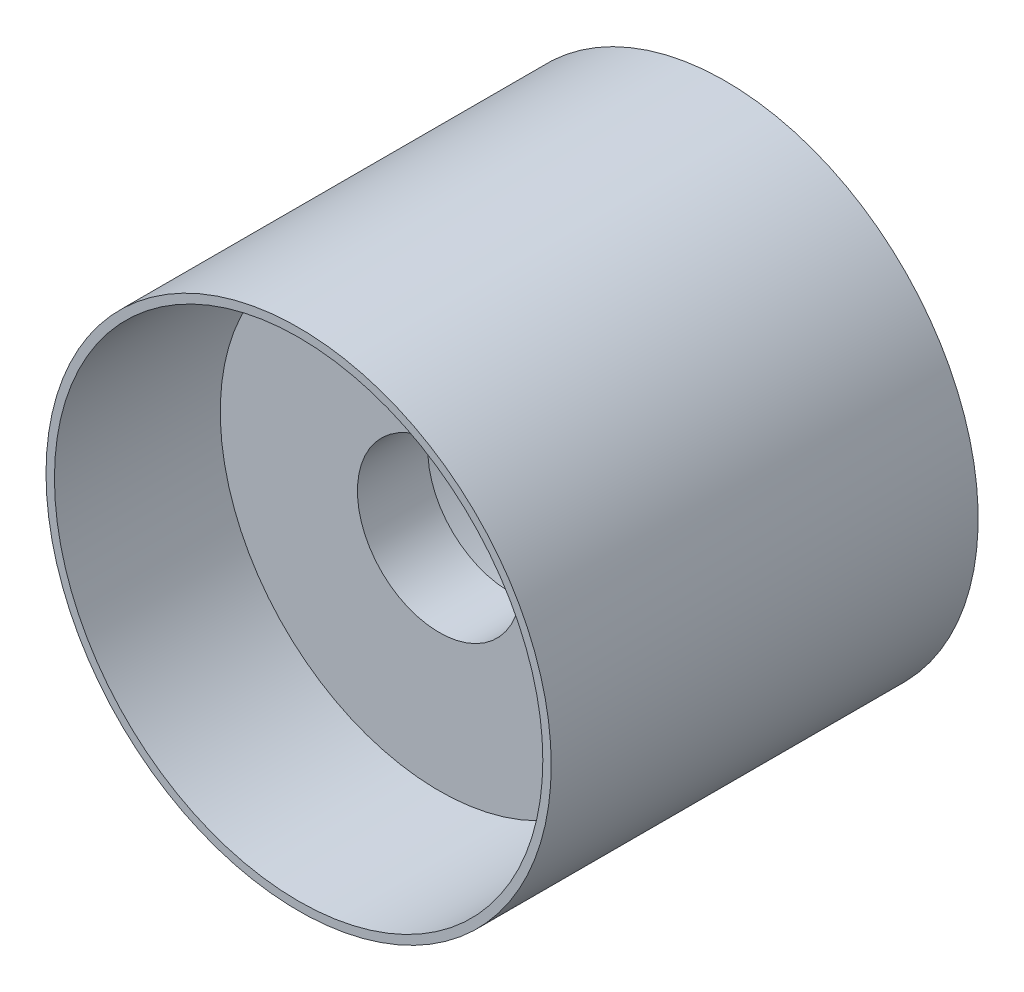
from build123d import *

# Parameters (mm, degrees)
BOSS_EXTRUDE2_DEPTH      = 259
BOSS_EXTRUDE2_DEPTH_BACK = 238
SKETCH5_R                = 300
SKETCH5_R_2              = 290
CUT_EXTRUDE1_DEPTH       = 186
CUT_EXTRUDE1_DEPTH_BACK  = 76
SKETCH6_R                = 97.102355
SKETCH7_R                = 300
BOSS_EXTRUDE5_DEPTH      = 10
SKETCH8_W                = 63.782423146
SKETCH8_H                = 50
SKETCH8_W_2              = 63.78242
BOSS_EXTRUDE6_DEPTH      = 10
SKETCH9_W                = 7.546412457
SKETCH9_H                = 50
BOSS_EXTRUDE7_DEPTH      = 80
SKETCH10_W               = 7.262070367
SKETCH10_H               = 50
BOSS_EXTRUDE8_DEPTH      = 158.04274
SKETCH13_W               = 7.54641
SKETCH13_H               = 50
BOSS_EXTRUDE9_DEPTH      = 80
FILLET3_R                = 5


with BuildPart() as part:
    # Sketch3 → Revolve2 (revolve)
    with BuildSketch(Plane(origin=(0, 0, 0), x_dir=(1, 0, 0), z_dir=(0, 1, 0))):
        Polygon((0, 41.453192435), (260, -92.06405694), (0, -92.06405694), align=None)
    revolve(axis=Axis((0, 0, 92.06405694), (0, 0, -1)))

    # Sketch6 → Cut-Extrude1 (cut, two sides: drawn at the far end of the back side and taken through both)
    with BuildSketch(Plane.XY.offset(-CUT_EXTRUDE1_DEPTH_BACK)):
        Circle(SKETCH6_R)
    extrude(amount=CUT_EXTRUDE1_DEPTH + CUT_EXTRUDE1_DEPTH_BACK, mode=Mode.SUBTRACT)


with BuildPart() as body_2:
    # Sketch5 → Boss-Extrude2 (new, two sides: drawn at the far end of the back side and taken through both)
    with BuildSketch(Plane.XY.offset(-BOSS_EXTRUDE2_DEPTH_BACK)):
        Circle(SKETCH5_R)
        Circle(SKETCH5_R_2, mode=Mode.SUBTRACT)
    extrude(amount=BOSS_EXTRUDE2_DEPTH + BOSS_EXTRUDE2_DEPTH_BACK)

    # Sketch7 → Boss-Extrude5 (add)
    with BuildSketch(Plane(origin=(0, 0, -238), x_dir=(-1, 0, 0), z_dir=(0, 0, -1))):
        Circle(SKETCH7_R)
    extrude(amount=BOSS_EXTRUDE5_DEPTH)

    # Sketch8 → Boss-Extrude6 (add)
    with BuildSketch(Plane(origin=(0, 0, -248), x_dir=(-1, 0, 0), z_dir=(0, 0, -1))):
        with Locations((-110.912578662, 0)):
            Rectangle(SKETCH8_W, SKETCH8_H)
        with Locations((110.91258, 0)):
            Rectangle(SKETCH8_W_2, SKETCH8_H)
    extrude(amount=BOSS_EXTRUDE6_DEPTH)

    # Sketch9 → Boss-Extrude7 (add)
    with BuildSketch(Plane(origin=(0, 0, -258), x_dir=(-1, 0, 0), z_dir=(0, 0, -1))):
        with Locations((-82.794573318, 0)):
            Rectangle(SKETCH9_W, SKETCH9_H)
    extrude(amount=BOSS_EXTRUDE7_DEPTH)

    # Sketch10 → Boss-Extrude8 (add)
    with BuildSketch(Plane.ZY.offset(-79.021367089)):
        with Locations((-334.368964817, 0)):
            Rectangle(SKETCH10_W, SKETCH10_H)
    extrude(amount=BOSS_EXTRUDE8_DEPTH)

    # Sketch13 → Boss-Extrude9 (add)
    with BuildSketch(Plane(origin=(0, 0, -258), x_dir=(-1, 0, 0), z_dir=(0, 0, -1))):
        with Locations((82.794575, 0)):
            Rectangle(SKETCH13_W, SKETCH13_H)
    extrude(amount=BOSS_EXTRUDE9_DEPTH)

    # Fillet3
    # the kernel refuses this fillet: 5 mm, written as the material it adds along each edge
    with BuildSketch(Plane(origin=(86.567779546, 25, -258), x_dir=(1, 0, 0), z_dir=(0, -1, 0))) as fillet3_piece_1:
        with BuildLine():
            CenterArc((FILLET3_R, -FILLET3_R), FILLET3_R, 90, 90)
            Line((0, -FILLET3_R), (0, 0))
            Line((0, 0), (FILLET3_R, 0))
        make_face()
    fillet3_piece_1_solid = extrude(amount=50, mode=Mode.PRIVATE)
    with BuildSketch(Plane(origin=(-79.02137, -25, -330.737929633), x_dir=(0, 0, 1), z_dir=(0, 1, 0)), Plane(origin=(-86.56778, 25, -258), x_dir=(-1, 0, 0), z_dir=(0, -1, 0))) as fillet3_piece_2:
        with BuildLine():
            CenterArc((FILLET3_R, FILLET3_R), FILLET3_R, 180, 90)
            Line((0, FILLET3_R), (0, 0))
            Line((0, 0), (FILLET3_R, 0))
        make_face()
    fillet3_piece_2_solid = extrude(amount=50, mode=Mode.PRIVATE)
    add([fillet3_piece_1_solid, fillet3_piece_2_solid])
    # the kernel refuses this fillet: 5 mm, written as the material it takes off along each edge
    with BuildSketch(Plane(origin=(142.803790235, 37.5, -258), x_dir=(0, 0, 1), z_dir=(0, -1, 0)), Plane(origin=(-142.80379, -37.5, -258), x_dir=(0, 0, 1), z_dir=(0, 1, 0)), Plane(origin=(86.567779546, 37.5, -338), x_dir=(0, 0, 1), z_dir=(0, -1, 0))) as fillet3_2_piece_1:
        with BuildLine():
            CenterArc((FILLET3_R, FILLET3_R), FILLET3_R, 180, 90)
            Line((0, FILLET3_R), (0, 0))
            Line((0, 0), (FILLET3_R, 0))
        make_face()
    fillet3_2_piece_1_solid = extrude(amount=75, mode=Mode.PRIVATE)
    with BuildSketch(Plane(origin=(79.021367089, 25, -338), x_dir=(0, 0, 1), z_dir=(-1, 0, 0))) as fillet3_2_piece_2:
        with BuildLine():
            CenterArc((FILLET3_R, -FILLET3_R), FILLET3_R, 90, 90)
            Line((0, -FILLET3_R), (0, 0))
            Line((0, 0), (FILLET3_R, 0))
        make_face()
    fillet3_2_piece_2_solid = extrude(amount=158.042737089, mode=Mode.PRIVATE)
    with BuildSketch(Plane(origin=(-79.02137, 25, -338), x_dir=(0, 0, 1), z_dir=(-1, 0, 0))) as fillet3_2_piece_3:
        with BuildLine():
            CenterArc((FILLET3_R, -FILLET3_R), FILLET3_R, 90, 90)
            Line((0, -FILLET3_R), (0, 0))
            Line((0, 0), (FILLET3_R, 0))
        make_face()
    fillet3_2_piece_3_solid = extrude(amount=2.911e-06, mode=Mode.PRIVATE)
    with BuildSketch(Plane(origin=(79.021367089, -25, -338), x_dir=(0, 0, 1), z_dir=(-1, 0, 0))) as fillet3_2_piece_4:
        with BuildLine():
            CenterArc((FILLET3_R, FILLET3_R), FILLET3_R, 180, 90)
            Line((0, FILLET3_R), (0, 0))
            Line((0, 0), (FILLET3_R, 0))
        make_face()
    fillet3_2_piece_4_solid = extrude(amount=158.042737089, mode=Mode.PRIVATE)
    with BuildSketch(Plane(origin=(-79.02137, -25, -338), x_dir=(0, 0, 1), z_dir=(-1, 0, 0))) as fillet3_2_piece_5:
        with BuildLine():
            CenterArc((FILLET3_R, FILLET3_R), FILLET3_R, 180, 90)
            Line((0, FILLET3_R), (0, 0))
            Line((0, 0), (FILLET3_R, 0))
        make_face()
    fillet3_2_piece_5_solid = extrude(amount=2.911e-06, mode=Mode.PRIVATE)
    with BuildSketch(Plane(origin=(99.067779546, -25, -338), x_dir=(0, 0, 1), z_dir=(-1, 0, 0)), Plane(origin=(79.021367089, 25, -338), x_dir=(0, 0, 1), z_dir=(1, 0, 0))) as fillet3_2_piece_6:
        with BuildLine():
            CenterArc((FILLET3_R, FILLET3_R), FILLET3_R, 180, 90)
            Line((0, FILLET3_R), (0, 0))
            Line((0, 0), (FILLET3_R, 0))
        make_face()
    fillet3_2_piece_6_solid = extrude(amount=20.046412458, mode=Mode.PRIVATE)
    with BuildSketch(Plane(origin=(-99.06778, -25, -338), x_dir=(0, 0, 1), z_dir=(1, 0, 0)), Plane(origin=(-79.021372911, 25, -338), x_dir=(0, 0, 1), z_dir=(-1, 0, 0))) as fillet3_2_piece_7:
        with BuildLine():
            CenterArc((FILLET3_R, -FILLET3_R), FILLET3_R, 90, 90)
            Line((0, -FILLET3_R), (0, 0))
            Line((0, 0), (FILLET3_R, 0))
        make_face()
    fillet3_2_piece_7_solid = extrude(amount=20.046407089, mode=Mode.PRIVATE)
    add([fillet3_2_piece_1_solid, fillet3_2_piece_2_solid, fillet3_2_piece_3_solid, fillet3_2_piece_4_solid, fillet3_2_piece_5_solid, fillet3_2_piece_6_solid, fillet3_2_piece_7_solid], mode=Mode.SUBTRACT)
    # the kernel refuses this fillet: 5 mm, written as the material it takes off along each edge
    with BuildSketch(Plane(origin=(81.567779546, -20, -333), x_dir=(1, 0, 0), z_dir=(0, -1, 0))) as fillet3_3_piece_1_section:
        Polygon((0, 0), (FILLET3_R * 1.02, 0), (FILLET3_R * 1.02, -FILLET3_R * 1.02), (0, -FILLET3_R * 1.02), align=None)
    fillet3_3_piece_1 = extrude(amount=FILLET3_R * 1.02, mode=Mode.PRIVATE)
    fillet3_3_piece_1 = fillet3_3_piece_1 - Plane(origin=(81.567779546, -20, -333), x_dir=(-0.7071067811865475, 0, 0.7071067811865475), z_dir=(0, -1, 0)) * Sphere(FILLET3_R, mode=Mode.PRIVATE)
    with BuildSketch(Plane(origin=(81.567779546, 20, -333), x_dir=(1, 0, 0), z_dir=(0, 1, 0))) as fillet3_3_piece_2_section:
        Polygon((0, 0), (FILLET3_R * 1.02, 0), (FILLET3_R * 1.02, FILLET3_R * 1.02), (0, FILLET3_R * 1.02), align=None)
    fillet3_3_piece_2 = extrude(amount=FILLET3_R * 1.02, mode=Mode.PRIVATE)
    fillet3_3_piece_2 = fillet3_3_piece_2 - Plane(origin=(81.567779546, 20, -333), x_dir=(-0.7071067811865475, 0, 0.7071067811865475), z_dir=(0, 1, 0)) * Sphere(FILLET3_R, mode=Mode.PRIVATE)
    with BuildSketch(Plane(origin=(150.303790235, -25, -258), x_dir=(0, 0, 1), z_dir=(-1, 0, 0)), Plane(origin=(91.567779546, 25, -258), x_dir=(0, 0, 1), z_dir=(1, 0, 0))) as fillet3_3_piece_3:
        with BuildLine():
            CenterArc((FILLET3_R, FILLET3_R), FILLET3_R, 180, 90)
            Line((0, FILLET3_R), (0, 0))
            Line((0, 0), (FILLET3_R, 0))
        make_face()
    fillet3_3_piece_3_solid = extrude(amount=58.736010689, mode=Mode.PRIVATE)
    with BuildSketch(Plane(origin=(-150.30379, 25, -258), x_dir=(0, 0, 1), z_dir=(1, 0, 0)), Plane(origin=(-91.56778, -25, -258), x_dir=(0, 0, 1), z_dir=(-1, 0, 0))) as fillet3_3_piece_4:
        with BuildLine():
            CenterArc((FILLET3_R, FILLET3_R), FILLET3_R, 180, 90)
            Line((0, FILLET3_R), (0, 0))
            Line((0, 0), (FILLET3_R, 0))
        make_face()
    fillet3_3_piece_4_solid = extrude(amount=58.73601, mode=Mode.PRIVATE)
    with BuildSketch(Plane(origin=(86.567779546, 25, -263), x_dir=(-1, 0, 0), z_dir=(0, 0, -1))) as fillet3_3_piece_5:
        with BuildLine():
            CenterArc((FILLET3_R, -FILLET3_R), FILLET3_R, 90, 90)
            Line((0, -FILLET3_R), (0, 0))
            Line((0, 0), (FILLET3_R, 0))
        make_face()
    fillet3_3_piece_5_solid = extrude(amount=70, mode=Mode.PRIVATE)
    with BuildSketch(Plane(origin=(86.567779546, -25, -263), x_dir=(-1, 0, 0), z_dir=(0, 0, -1))) as fillet3_3_piece_6:
        with BuildLine():
            CenterArc((FILLET3_R, FILLET3_R), FILLET3_R, 180, 90)
            Line((0, FILLET3_R), (0, 0))
            Line((0, 0), (FILLET3_R, 0))
        make_face()
    fillet3_3_piece_6_solid = extrude(amount=70, mode=Mode.PRIVATE)
    with BuildSketch(Plane(origin=(-86.56778, -25, -263), x_dir=(1, 0, 0), z_dir=(0, 0, -1))) as fillet3_3_piece_7:
        with BuildLine():
            CenterArc((FILLET3_R, -FILLET3_R), FILLET3_R, 90, 90)
            Line((0, -FILLET3_R), (0, 0))
            Line((0, 0), (FILLET3_R, 0))
        make_face()
    fillet3_3_piece_7_solid = extrude(amount=82.5, mode=Mode.PRIVATE)
    with BuildSketch(Plane(origin=(-86.56778, 25, -263), x_dir=(1, 0, 0), z_dir=(0, 0, -1))) as fillet3_3_piece_8:
        with BuildLine():
            CenterArc((FILLET3_R, FILLET3_R), FILLET3_R, 180, 90)
            Line((0, FILLET3_R), (0, 0))
            Line((0, 0), (FILLET3_R, 0))
        make_face()
    fillet3_3_piece_8_solid = extrude(amount=82.5, mode=Mode.PRIVATE)
    with BuildSketch(Plane(origin=(-91.56778, 25, -263), x_dir=(0, 0, 1), z_dir=(-1, 0, 0))) as fillet3_3_piece_9:
        with BuildLine():
            CenterArc((5 + FILLET3_R, -FILLET3_R), FILLET3_R, 90, 90)
            Line((5, -FILLET3_R), (5, 0))
            Line((5, 0), (5 + FILLET3_R, 0))
        make_face()
    fillet3_3_piece_9_solid = revolve(axis=Axis((-91.56778, 25, -263), (0, 1, 0)), revolution_arc=90, mode=Mode.PRIVATE)
    with BuildSketch(Plane(origin=(-91.56778, -25, -263), x_dir=(0, 0, 1), z_dir=(-1, 0, 0))) as fillet3_3_piece_10:
        with BuildLine():
            CenterArc((5 + FILLET3_R, FILLET3_R), FILLET3_R, 180, 90)
            Line((5, FILLET3_R), (5, 0))
            Line((5, 0), (5 + FILLET3_R, 0))
        make_face()
    fillet3_3_piece_10_solid = revolve(axis=Axis((-91.56778, -25, -263), (0, 1, 0)), revolution_arc=90, mode=Mode.PRIVATE)
    with BuildSketch(Plane(origin=(91.567779546, -25, -263), x_dir=(0, 0, 1), z_dir=(1, 0, 0))) as fillet3_3_piece_11:
        with BuildLine():
            CenterArc((5 + FILLET3_R, -FILLET3_R), FILLET3_R, 90, 90)
            Line((5, -FILLET3_R), (5, 0))
            Line((5, 0), (5 + FILLET3_R, 0))
        make_face()
    fillet3_3_piece_11_solid = revolve(axis=Axis((91.567779546, -25, -263), (0, -1, 0)), revolution_arc=90, mode=Mode.PRIVATE)
    with BuildSketch(Plane(origin=(91.567779546, 25, -263), x_dir=(0, 0, 1), z_dir=(1, 0, 0))) as fillet3_3_piece_12:
        with BuildLine():
            CenterArc((5 + FILLET3_R, FILLET3_R), FILLET3_R, 180, 90)
            Line((5, FILLET3_R), (5, 0))
            Line((5, 0), (5 + FILLET3_R, 0))
        make_face()
    fillet3_3_piece_12_solid = revolve(axis=Axis((91.567779546, 25, -263), (0, -1, 0)), revolution_arc=90, mode=Mode.PRIVATE)
    add([fillet3_3_piece_1, fillet3_3_piece_2, fillet3_3_piece_3_solid, fillet3_3_piece_4_solid, fillet3_3_piece_5_solid, fillet3_3_piece_6_solid, fillet3_3_piece_7_solid, fillet3_3_piece_8_solid, fillet3_3_piece_9_solid, fillet3_3_piece_10_solid, fillet3_3_piece_11_solid, fillet3_3_piece_12_solid], mode=Mode.SUBTRACT)


solid = Compound([part.part, body_2.part])
